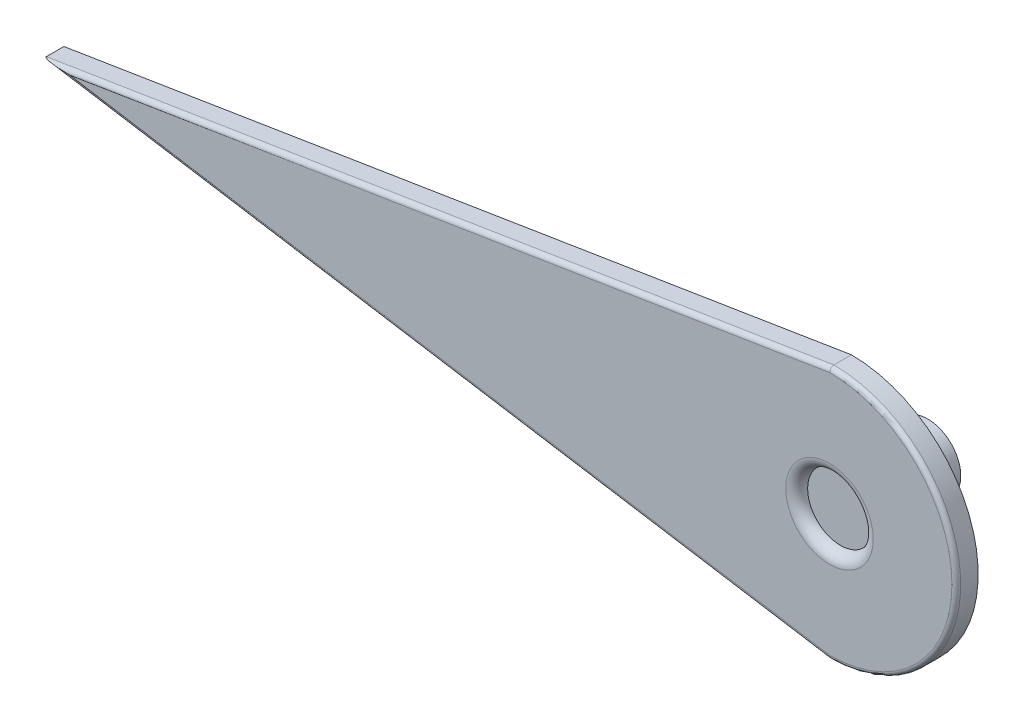
from build123d import *

# Parameters (mm, degrees)
SKETCH_1_R           = 0.15
EXTRUDE_1_DEPTH      = 0.1
EXTRUDE_2_DEPTH      = 0.35
EXTRUDE_2_DEPTH_BACK = 0.05
SKETCH_2_R           = 0.15
FILLET_1_R           = 0.05
FILLET_2_R           = 0.02


with BuildPart() as part:
    # Эскиз1 → Бобышка-Вытянуть1 (new body)
    with BuildSketch(Plane.XY):
        with BuildLine():
            Line((0, 0), (3.6, 0.579587254))
            ThreePointArc((3.6, 0.579587254), (4.179587254, 0), (3.6, -0.579587254))
            Line((3.6, -0.579587254), (0, 0))
        make_face()
        with Locations((3.6, 0)):
            Circle(SKETCH_1_R, mode=Mode.SUBTRACT)
    extrude(amount=EXTRUDE_1_DEPTH)

    # Скругление1
    fillet_1_edges = [part.edges().sort_by_distance(p)[0] for p in [
        (3.45, 0, 0.1),
    ]]
    fillet(fillet_1_edges, radius=FILLET_1_R)

    # Скругление2
    fillet_2_edges = [part.edges().sort_by_distance(p)[0] for p in [
        (4.179587254, 0, 0.1),
        (1.8, 0.289793627, 0.1),
        (1.8, -0.289793627, 0.1),
    ]]
    fillet(fillet_2_edges, radius=FILLET_2_R)


with BuildPart() as body_2:
    # Эскиз2 → Бобышка-Вытянуть2 (new, two sides: drawn at the far end of the back side and taken through both)
    with BuildSketch(Plane(origin=(0, 0, 0), x_dir=(-1, 0, 0), z_dir=(0, 0, -1)).offset(-EXTRUDE_2_DEPTH_BACK)):
        with Locations((-3.6, 0)):
            Circle(SKETCH_2_R)
    extrude(amount=EXTRUDE_2_DEPTH + EXTRUDE_2_DEPTH_BACK)


solid = Compound([part.part, body_2.part])
